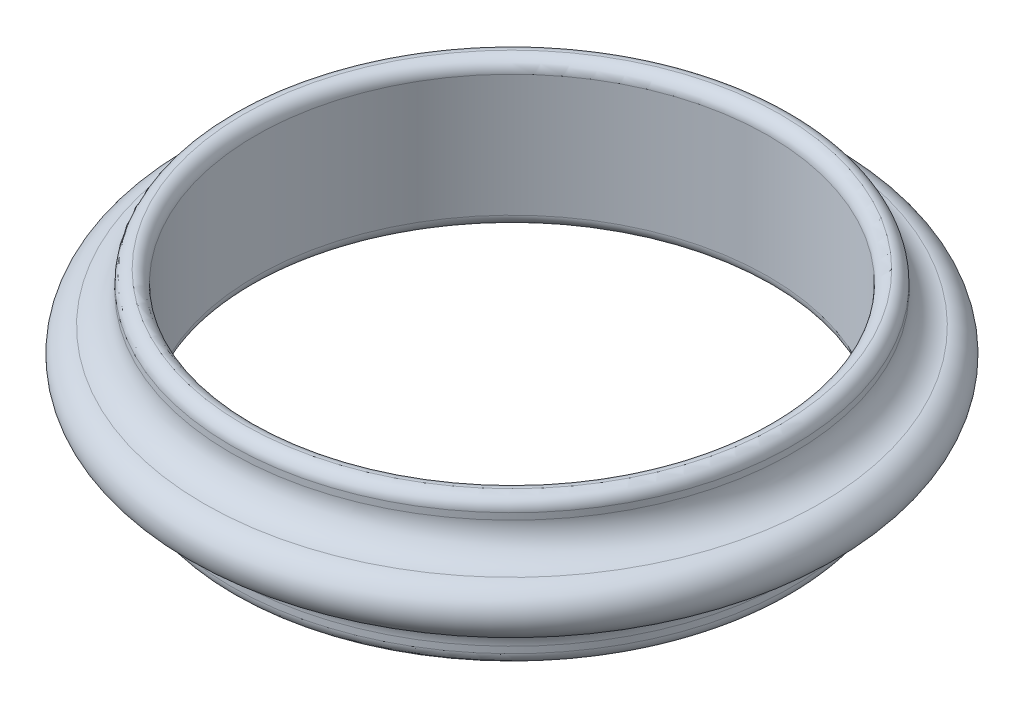
from build123d import *

# Parameters (mm, degrees)
FILLET_1_R = 1


with BuildPart() as part:
    # 草图1 → 旋转1 (revolve)
    with BuildSketch(Plane.XY, mode=Mode.PRIVATE) as revolve_1_sk:
        with BuildLine():
            Line((-23, 6), (-23, 4.472135955))
            ThreePointArc((-23, 4.472135955), (-23.636610019, 2.805469288), (-25.222222222, 1.98761598))
            ThreePointArc((-25.222222222, 1.98761598), (-27, 0), (-25.222222222, -1.98761598))
            ThreePointArc((-25.222222222, -1.98761598), (-23.636610019, -2.805469288), (-23, -4.472135955))
            Line((-23, -4.472135955), (-23, -6))
            Line((-23, -6), (-21, -6))
            Line((-21, -6), (-21, 6))
            Line((-21, 6), (-23, 6))
        make_face()
    revolve(revolve_1_sk.sketch.rotate(Axis((0, 18.72539369, 0), (0, -1, 0)), 270), axis=Axis((0, 18.72539369, 0), (0, -1, 0)))

    # 圆角1
    fillet_1_edges = [part.edges().sort_by_distance(p)[0] for p in [
        (0, -6, -23),
        (0, -6, -21),
        (0, 6, -21),
        (0, 6, -23),
    ]]
    fillet(fillet_1_edges, radius=FILLET_1_R - 0.0001)  # a hair under: the kernel refuses the full size


solid = part.part
